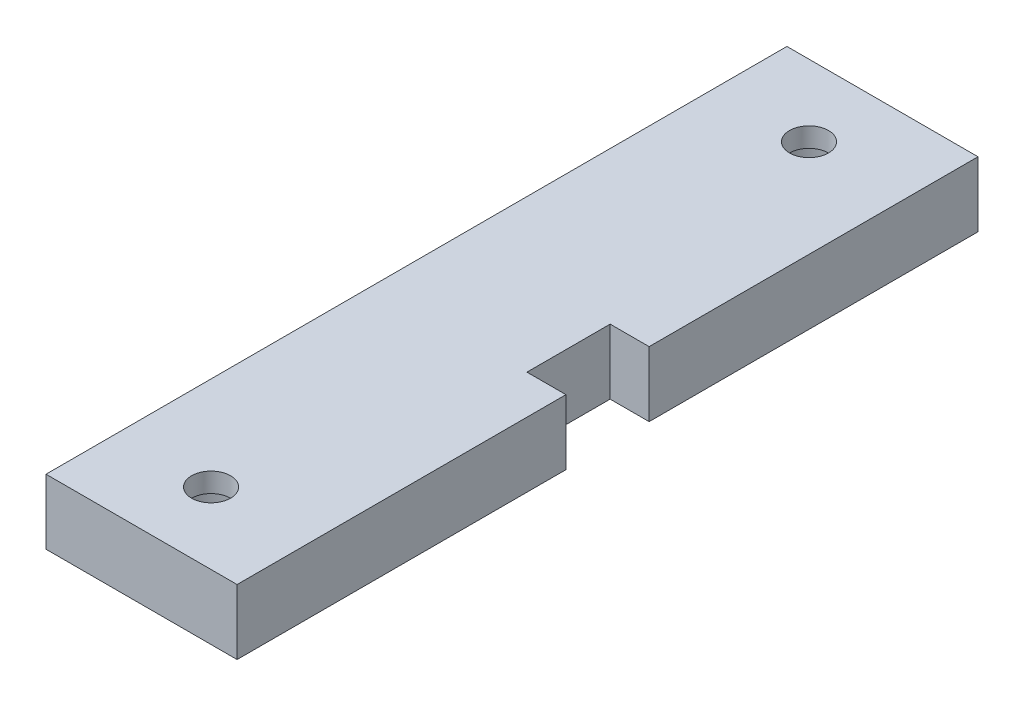
from build123d import *

# Parameters (mm, degrees)
SKETCH_2_W           = 21
SKETCH_2_H           = 57
EXTRUDE_1_DEPTH      = 5
SKETCH_3_R           = 1.5
CUT_EXTRUDE_1_DEPTH  = 5
SKETCH_4_R           = 1.5
CUT_EXTRUDE_2_DEPTH  = 5
SKETCH_5_R           = 3.5
CUT_EXTRUDE_3_DEPTH  = 3.5
SKETCH_6_R           = 3.5
CUT_EXTRUDE_4_DEPTH  = 3.5
SKETCH_8_W           = 3
SKETCH_8_H           = 57
CUT_EXTRUDE_5_DEPTH  = 5
CUT_EXTRUDE_7_DEPTH  = 5
SKETCH_11_W          = 0.3
SKETCH_11_H          = 28.5
CUT_EXTRUDE_8_DEPTH  = 5
SKETCH_12_W          = 0.3
SKETCH_12_H          = 28.5
CUT_EXTRUDE_9_DEPTH  = 10
SKETCH_13_W          = 3
SKETCH_13_H          = 0.2
CUT_EXTRUDE_10_DEPTH = 10


with BuildPart() as part:
    # 草图2 → 凸台-拉伸1 (new body)
    with BuildSketch(Plane(origin=(0, 0, 0), x_dir=(1, 0, 0), z_dir=(0, 1, 0))):
        with Locations((-11.930654931, -13.970581751)):
            Rectangle(SKETCH_2_W, SKETCH_2_H)
    extrude(amount=EXTRUDE_1_DEPTH)

    # 草图3 → 切除-拉伸1 (cut)
    with BuildSketch(Plane(origin=(0, 5, 0), x_dir=(1, 0, 0), z_dir=(0, 1, 0))):
        with Locations((-11.930654931, -36.970581751)):
            Circle(SKETCH_3_R)
    extrude(amount=-CUT_EXTRUDE_1_DEPTH, mode=Mode.SUBTRACT)

    # 草图4 → 切除-拉伸2 (cut)
    with BuildSketch(Plane(origin=(0, 5, 0), x_dir=(1, 0, 0), z_dir=(0, 1, 0))):
        with Locations((-11.930654931, 9.029418249)):
            Circle(SKETCH_4_R)
    extrude(amount=-CUT_EXTRUDE_2_DEPTH, mode=Mode.SUBTRACT)

    # 草图5 → 切除-拉伸3 (cut)
    with BuildSketch(Plane.XZ):
        with Locations((-11.930654931, -9.029418249)):
            Circle(SKETCH_5_R)
    extrude(amount=-CUT_EXTRUDE_3_DEPTH, mode=Mode.SUBTRACT)

    # 草图6 → 切除-拉伸4 (cut)
    with BuildSketch(Plane.XZ):
        with Locations((-11.930654931, 36.970581751)):
            Circle(SKETCH_6_R)
    extrude(amount=-CUT_EXTRUDE_4_DEPTH, mode=Mode.SUBTRACT)

    # 草图8 → 切除-拉伸5 (cut)
    with BuildSketch(Plane(origin=(0, 5, 0), x_dir=(1, 0, 0), z_dir=(0, 1, 0))):
        with Locations((-20.930654931, -13.970581751)):
            Rectangle(SKETCH_8_W, SKETCH_8_H)
        with Locations((-2.930654931, -13.970581751)):
            Rectangle(SKETCH_8_W, SKETCH_8_H)
    extrude(amount=-CUT_EXTRUDE_5_DEPTH, mode=Mode.SUBTRACT)

    # 草图10 → 切除-拉伸7 (cut)
    with BuildSketch(Plane(origin=(0, 5, 0), x_dir=(1, 0, 0), z_dir=(0, 1, 0))):
        Polygon((-4.430654931, -13.970581751), (-4.430654931, -10.970581751), (-7.430654931, -10.970581751), (-7.430654931, -16.970581751), (-4.430654931, -16.970581751), align=None)
    extrude(amount=-CUT_EXTRUDE_7_DEPTH, mode=Mode.SUBTRACT)

    # 草图11 → 切除-拉伸8 (cut)
    with BuildSketch(Plane.XZ):
        with Locations((-19.280654931, 28.220581751)):
            Rectangle(SKETCH_11_W, SKETCH_11_H)
    extrude(amount=-CUT_EXTRUDE_8_DEPTH, mode=Mode.SUBTRACT)

    # 草图12 → 切除-拉伸9 (cut)
    with BuildSketch(Plane(origin=(0, 0, 0), x_dir=(-1, 0, 0), z_dir=(0, -1, 0))):
        with Locations((19.280654931, 0.279418249)):
            Rectangle(SKETCH_12_W, SKETCH_12_H)
    extrude(amount=-CUT_EXTRUDE_9_DEPTH, mode=Mode.SUBTRACT)

    # 草图13 → 切除-拉伸10 (cut)
    with BuildSketch(Plane.XZ):
        with Locations((-5.930654931, 10.870581751)):
            Rectangle(SKETCH_13_W, SKETCH_13_H)
        with Locations((-5.930654931, 17.070581751)):
            Rectangle(SKETCH_13_W, SKETCH_13_H)
    extrude(amount=-CUT_EXTRUDE_10_DEPTH, mode=Mode.SUBTRACT)


solid = part.part
